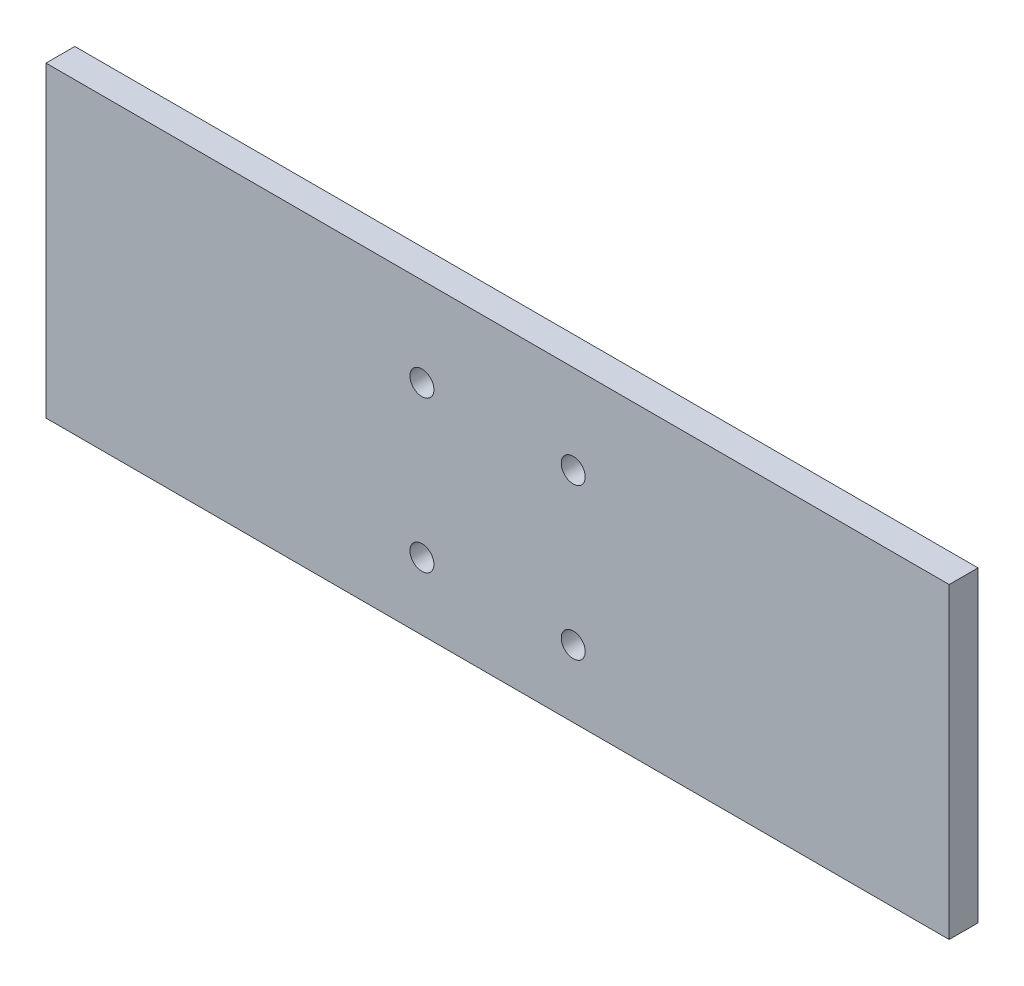
from build123d import *

# Parameters (mm, degrees)
SKETCH1_W           = 596.9
SKETCH1_H           = 203.2
BOSS_EXTRUDE1_DEPTH = 9.525
SKETCH2_R           = 7.9375
CUT_EXTRUDE1_DEPTH  = 316.844684932


with BuildPart() as part:
    # Sketch1 → Boss-Extrude1 (new, symmetric)
    with BuildSketch(Plane.XY):
        Rectangle(SKETCH1_W, SKETCH1_H)
    extrude(amount=BOSS_EXTRUDE1_DEPTH, both=True)

    # Sketch2 → Cut-Extrude1 (cut, through all)
    with BuildSketch(Plane.XY.offset(9.525)):
        with Locations((-50, 42.85)):
            Circle(SKETCH2_R)
        with Locations((-50, -57.15)):
            Circle(SKETCH2_R)
        with Locations((50, 42.85)):
            Circle(SKETCH2_R)
        with Locations((50, -57.15)):
            Circle(SKETCH2_R)
    extrude(amount=-CUT_EXTRUDE1_DEPTH, mode=Mode.SUBTRACT)


solid = part.part
